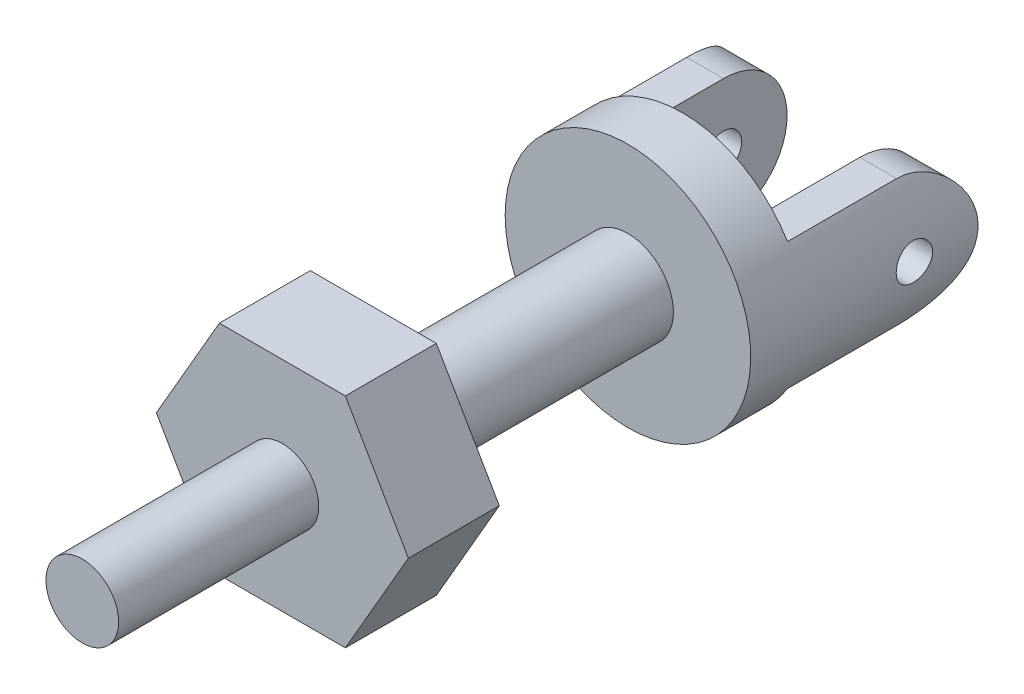
from build123d import *
from build123d.topology import SkipClean

# Parameters (mm, degrees)
HEXAGON_DEPTH            = 5
SKETCH3_R                = 2
SCREW_POST_DEPTH         = 11
SKETCH4_R                = 2.5
BEARING_SECTION_DEPTH    = 14
SKETCH5_R                = 6.75
U_JOINT_BASE_DEPTH       = 3
U_JOINT_STANDUPS_DEPTH   = 9.5
STANDUP_ROUND_DEPTH      = 29.210148883
STANDUP_ROUND_DEPTH_BACK = 29.210148883
BALL_HOLES_DEPTH         = 29.210148977
BALL_HOLES_DEPTH_BACK    = 29.210148977
SKETCH8_R                = 1


with BuildPart() as part:
    # Sketch2 → Hexagon (new body)
    with BuildSketch(Plane.XY):
        Polygon((3.464101615, -6), (6.92820323, 0), (3.464101615, 6), (-3.464101615, 6), (-6.92820323, 0), (-3.464101615, -6), align=None)
    extrude(amount=HEXAGON_DEPTH)

    # Sketch3 → Screw Post (add)
    with BuildSketch(Plane.XY.offset(5)):
        Circle(SKETCH3_R)
    extrude(amount=SCREW_POST_DEPTH)

    # Sketch4 → Bearing Section (add)
    with BuildSketch(Plane(origin=(0, 0, 0), x_dir=(-1, 0, 0), z_dir=(0, 0, -1))):
        Circle(SKETCH4_R)
    extrude(amount=BEARING_SECTION_DEPTH)

    # Sketch5 → U Joint Base (add)
    with BuildSketch(Plane(origin=(0, 0, -14), x_dir=(-1, 0, 0), z_dir=(0, 0, -1))):
        Circle(SKETCH5_R)
    extrude(amount=U_JOINT_BASE_DEPTH)

    # Sketch6 → U Joint Standups (add)
    with SkipClean():  # the faces are left unmerged after this step: merging them gives an invalid solid
        with BuildSketch(Plane(origin=(0, 0, -17), x_dir=(-1, 0, 0), z_dir=(0, 0, -1))):
            with BuildLine():
                Line((-5.77169819, 3.5), (-3.75, 3.5))
                Line((-3.75, 3.5), (-3.75, -3.5))
                Line((-3.75, -3.5), (-5.77169819, -3.5))
                ThreePointArc((-5.77169819, -3.5), (-6.75, 0), (-5.77169819, 3.5))
            make_face()
            with BuildLine():
                Line((3.75, -3.5), (3.75, 3.5))
                Line((3.75, 3.5), (5.77169819, 3.5))
                ThreePointArc((5.77169819, 3.5), (6.75, 0), (5.77169819, -3.5))
                Line((5.77169819, -3.5), (3.75, -3.5))
            make_face()
        extrude(amount=U_JOINT_STANDUPS_DEPTH)

    # Sketch7 → Standup Round (cut, two sides: drawn at the far end of the back side and taken through both)
    with SkipClean():  # the faces are left unmerged after this step: merging them gives an invalid solid
        with BuildSketch(Plane(origin=(0, 0, 0), x_dir=(0, 0, -1), z_dir=(1, 0, 0)).offset(-STANDUP_ROUND_DEPTH_BACK)):
            with BuildLine():
                Line((26.5, -3.5), (26.5, 1e-08))
                ThreePointArc((26.5, 1e-08), (25.474873738, -2.474873731), (23, -3.5))
                Line((23, -3.5), (26.5, -3.5))
            make_face()
            with BuildLine():
                Line((26.5, 3.5), (23, 3.5))
                ThreePointArc((23, 3.5), (25.474873731, 2.474873738), (26.5, 1e-08))
                Line((26.5, 1e-08), (26.5, 3.5))
            make_face()
        extrude(amount=STANDUP_ROUND_DEPTH + STANDUP_ROUND_DEPTH_BACK, mode=Mode.SUBTRACT)

    # Sketch8 → Ball Holes (cut, two sides: drawn at the far end of the back side and taken through both)
    with SkipClean():  # the faces are left unmerged after this step: merging them gives an invalid solid
        with BuildSketch(Plane(origin=(0, 0, 0), x_dir=(0, 0, -1), z_dir=(1, 0, 0)).offset(-BALL_HOLES_DEPTH_BACK)):
            with Locations((23, 0)):
                Circle(SKETCH8_R)
        extrude(amount=BALL_HOLES_DEPTH + BALL_HOLES_DEPTH_BACK, mode=Mode.SUBTRACT)


solid = part.part
